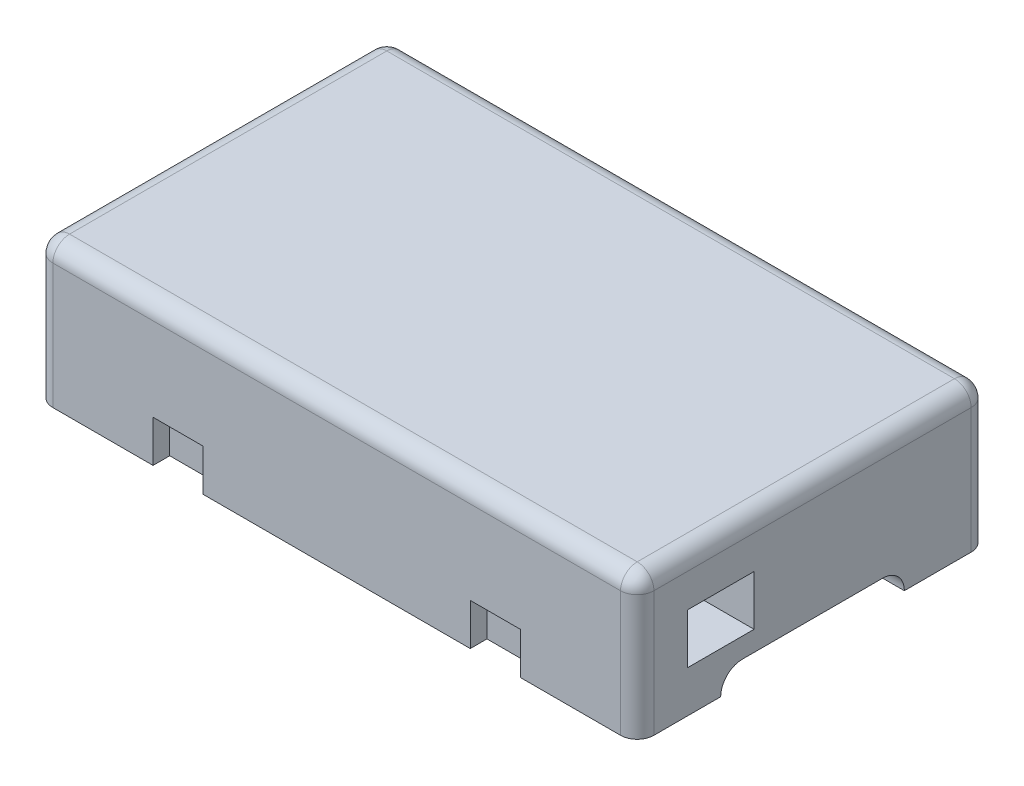
from build123d import *

# Parameters (mm, degrees)
SKETCH1_W           = 36
SKETCH1_H           = 21
BOSS_EXTRUDE2_DEPTH = 15
CUT_EXTRUDE1_DEPTH  = 15
SKETCH5_W           = 30
SKETCH5_H           = 15
CUT_EXTRUDE2_DEPTH  = 3.5
SKETCH7_W           = 30
SKETCH7_H           = 15
CUT_EXTRUDE3_DEPTH  = 5.5
FILLET1_R           = 1
FILLET2_R           = 1
SKETCH9_W           = 3
SKETCH9_H           = 3
BOSS_EXTRUDE3_DEPTH = 1
SKETCH9_4_W         = 3
SKETCH9_4_H         = 3
BOSS_EXTRUDE4_DEPTH = 1
SKETCH10_W          = 3
SKETCH10_H          = 1.5
BOSS_EXTRUDE5_DEPTH = 1
CUT_EXTRUDE4_DEPTH  = 35.296501279
SKETCH12_W          = 3
SKETCH12_H          = 6
BOSS_EXTRUDE6_DEPTH = 0.5
FILLET3_R           = 11
FILLET4_R           = 0.5
SKETCH17_W          = 3
SKETCH17_H          = 2
BOSS_EXTRUDE7_DEPTH = 1
SKETCH18_W          = 3
SKETCH18_H          = 1.5
BOSS_EXTRUDE8_DEPTH = 1
FILLET5_R           = 0.75
FILLET6_START       = -1.5
FILLET6_DEPTH       = 3
SKETCH19_W          = 3
SKETCH19_H          = 1
CUT_EXTRUDE5_DEPTH  = 8
SKETCH20_W          = 3
SKETCH20_H          = 2.565888667
CUT_EXTRUDE6_DEPTH  = 8
SKETCH21_W          = 4
SKETCH21_H          = 3
CUT_EXTRUDE7_DEPTH  = 8


with BuildPart() as part:
    # Sketch1 → Boss-Extrude2 (new body)
    with BuildSketch(Plane(origin=(0, 0, 0), x_dir=(1, 0, 0), z_dir=(0, 1, 0))):
        Rectangle(SKETCH1_W, SKETCH1_H)
    extrude(amount=BOSS_EXTRUDE2_DEPTH)

    # Sketch2 → Cut-Extrude1 (cut)
    with BuildSketch(Plane(origin=(18, 0, 0), x_dir=(0, 0, -1), z_dir=(1, 0, 0))):
        with BuildLine():
            Line((-4.2, 7.8), (4.2, 7.8))
            ThreePointArc((4.2, 7.8), (5.5, 6.5), (4.2, 5.2))
            Line((4.2, 5.2), (-4.2, 5.2))
            ThreePointArc((-4.2, 5.2), (-5.5, 6.5), (-4.2, 7.8))
        make_face()
    extrude(amount=-CUT_EXTRUDE1_DEPTH, mode=Mode.SUBTRACT)


with BuildPart() as body_2:
    # Split1: the piece on the far side of the plane
    add(part.part)
    split(bisect_by=Plane.ZX.offset(6.5), keep=Keep.BOTTOM)

    # Sketch5 → Cut-Extrude2 (cut)
    with BuildSketch(Plane(origin=(0, 6.5, 0), x_dir=(1, 0, 0), z_dir=(0, 1, 0))):
        Rectangle(SKETCH5_W, SKETCH5_H)
    extrude(amount=-CUT_EXTRUDE2_DEPTH, mode=Mode.SUBTRACT)

    # Fillet2
    fillet2_edges = [body_2.edges().sort_by_distance(p)[0] for p in [
        (18, 0, 0),
        (0, 0, -10.5),
        (-18, 0, 0),
        (0, 0, 10.5),
        (18, 3.25, 10.5),
        (-18, 3.25, 10.5),
        (-18, 3.25, -10.5),
        (18, 3.25, -10.5),
    ]]
    fillet(fillet2_edges, radius=FILLET2_R)

    # Sketch9 → Boss-Extrude3 (add)
    with BuildSketch(Plane.XY.offset(10.5)):
        with Locations((-9.5, 8)):
            Rectangle(SKETCH9_W, SKETCH9_H)
    extrude(amount=-BOSS_EXTRUDE3_DEPTH)

    # Sketch9<4> → Boss-Extrude4 (add)
    with BuildSketch(Plane.XY.offset(10.5)):
        with Locations((9.5, 8)):
            Rectangle(SKETCH9_4_W, SKETCH9_4_H)
    extrude(amount=-BOSS_EXTRUDE4_DEPTH)

    # Sketch10 → Boss-Extrude5 (add)
    with BuildSketch(Plane(origin=(0, 0, 9.5), x_dir=(-1, 0, 0), z_dir=(0, 0, -1))):
        with Locations((-9.5, 8.75)):
            Rectangle(SKETCH10_W, SKETCH10_H)
        with Locations((9.5, 8.75)):
            Rectangle(SKETCH10_W, SKETCH10_H)
    extrude(amount=BOSS_EXTRUDE5_DEPTH)

    # Sketch11 → Cut-Extrude4 (cut, through all)
    with BuildSketch(Plane(origin=(11, 0, 0), x_dir=(0, 0, -1), z_dir=(1, 0, 0))):
        Polygon((-9.5, 9.5), (-8.5, 8), (-8.5, 9.5), align=None)
    extrude(amount=-CUT_EXTRUDE4_DEPTH, mode=Mode.SUBTRACT)

    # Sketch12 → Boss-Extrude6 (add, symmetric)
    with BuildSketch(Plane(origin=(0, 0, -10.5), x_dir=(-1, 0, 0), z_dir=(0, 0, -1))):
        with Locations((0, 6.5)):
            Rectangle(SKETCH12_W, SKETCH12_H)
    extrude(amount=BOSS_EXTRUDE6_DEPTH, both=True)

    # Fillet3
    # the kernel refuses this fillet: 11 mm, written as the material it takes off along each edge
    with BuildSketch(Plane(origin=(-9.696798155, 3.5, -11), x_dir=(0, 0, 1), z_dir=(1, 0, 0))) as fillet3_piece_1:
        with BuildLine():
            CenterArc((11, -3.278719262), FILLET3_R, 162.658557197, 17.341442803)
            Line((0, -3.278719262), (-0.22, -3.278719262))
            Line((-0.22, -3.278719262), (-0.22, 0))
            Line((-0.22, 0), (0, 0.22))
            ThreePointArc((0, 0.22), (0.25, 0.22), (0.29, 0.065574385))
            Line((0.29, 0.065574385), (0.5, 0))
        make_face()
    extrude(amount=19.393596311, mode=Mode.SUBTRACT)

    # Fillet4
    fillet4_edges = [body_2.edges().sort_by_distance(p)[0] for p in [
        (-9.5, 9.5, 9.5),
        (9.5, 9.5, 9.5),
        (-9.5, 9.5, 10.5),
        (9.5, 9.5, 10.5),
    ]]
    fillet(fillet4_edges, radius=FILLET4_R)

    # Sketch17 → Boss-Extrude7 (add)
    with BuildSketch(Plane.XY.offset(-10)):
        with Locations((0, 10.5)):
            Rectangle(SKETCH17_W, SKETCH17_H)
    extrude(amount=-BOSS_EXTRUDE7_DEPTH)

    # Sketch18 → Boss-Extrude8 (add)
    with BuildSketch(Plane.XY.offset(-10)):
        with Locations((0, 9.25)):
            Rectangle(SKETCH18_W, SKETCH18_H)
    extrude(amount=BOSS_EXTRUDE8_DEPTH)

    # Fillet5
    fillet5_edges = [body_2.edges().sort_by_distance(p)[0] for p in [
        (0, 8.5, -9),
        (0, 10, -9),
    ]]
    fillet(fillet5_edges, radius=FILLET5_R - 0.0001)  # a hair under: the kernel refuses the full size

    # Fillet6: read off the stored shape, not the designer's step
    # Fillet6 outline → Fillet6 (cut)
    with BuildSketch(Plane.YZ.offset(FILLET6_START)):
        with BuildLine():
            add(Edge.make_bspline(
                [(11.5, -11), (11.5, -10), (10.5, -10)],
                knots=[0, 0, 0, 1, 1, 1], degree=2, weights=[1, 0.070710678, 1]))
            Line((11.5, -11), (11.5, -10))
            Line((11.5, -10), (10.5, -10))
        make_face()
    extrude(amount=FILLET6_DEPTH, mode=Mode.SUBTRACT)


with BuildPart() as part_1:
    add(part.part)

    # Split1
    split(bisect_by=Plane.ZX.offset(6.5), keep=Keep.TOP)

    # Sketch7 → Cut-Extrude3 (cut)
    with BuildSketch(Plane.XZ.offset(-6.5)):
        Rectangle(SKETCH7_W, SKETCH7_H)
    extrude(amount=-CUT_EXTRUDE3_DEPTH, mode=Mode.SUBTRACT)

    # Fillet1
    fillet1_edges = [part_1.edges().sort_by_distance(p)[0] for p in [
        (-18, 15, 0),
        (0, 15, 10.5),
        (18, 15, 0),
        (18, 10.75, 10.5),
        (-18, 10.75, 10.5),
        (-18, 10.75, -10.5),
        (18, 10.75, -10.5),
        (0, 15, -10.5),
    ]]
    fillet(fillet1_edges, radius=FILLET1_R)

    # Combine1: cut body 2
    add(body_2.part, mode=Mode.SUBTRACT)

    # Sketch19 → Cut-Extrude5 (cut)
    with BuildSketch(Plane.XY.offset(10.5)):
        with Locations((9.5, 8.5)):
            Rectangle(SKETCH19_W, SKETCH19_H)
        with Locations((-9.5, 8.5)):
            Rectangle(SKETCH19_W, SKETCH19_H)
    extrude(amount=-CUT_EXTRUDE5_DEPTH, mode=Mode.SUBTRACT)

    # Sketch20 → Cut-Extrude6 (cut)
    with BuildSketch(Plane(origin=(0, 0, -10.5), x_dir=(-1, 0, 0), z_dir=(0, 0, -1))):
        with Locations((0, 9.782944334)):
            Rectangle(SKETCH20_W, SKETCH20_H)
    extrude(amount=-CUT_EXTRUDE6_DEPTH, mode=Mode.SUBTRACT)

    # Sketch21 → Cut-Extrude7 (cut)
    with BuildSketch(Plane(origin=(18, 0, 0), x_dir=(0, 0, -1), z_dir=(1, 0, 0))):
        with Locations((-5.5, 10.5)):
            Rectangle(SKETCH21_W, SKETCH21_H)
    extrude(amount=-CUT_EXTRUDE7_DEPTH, mode=Mode.SUBTRACT)


solid = part_1.part
